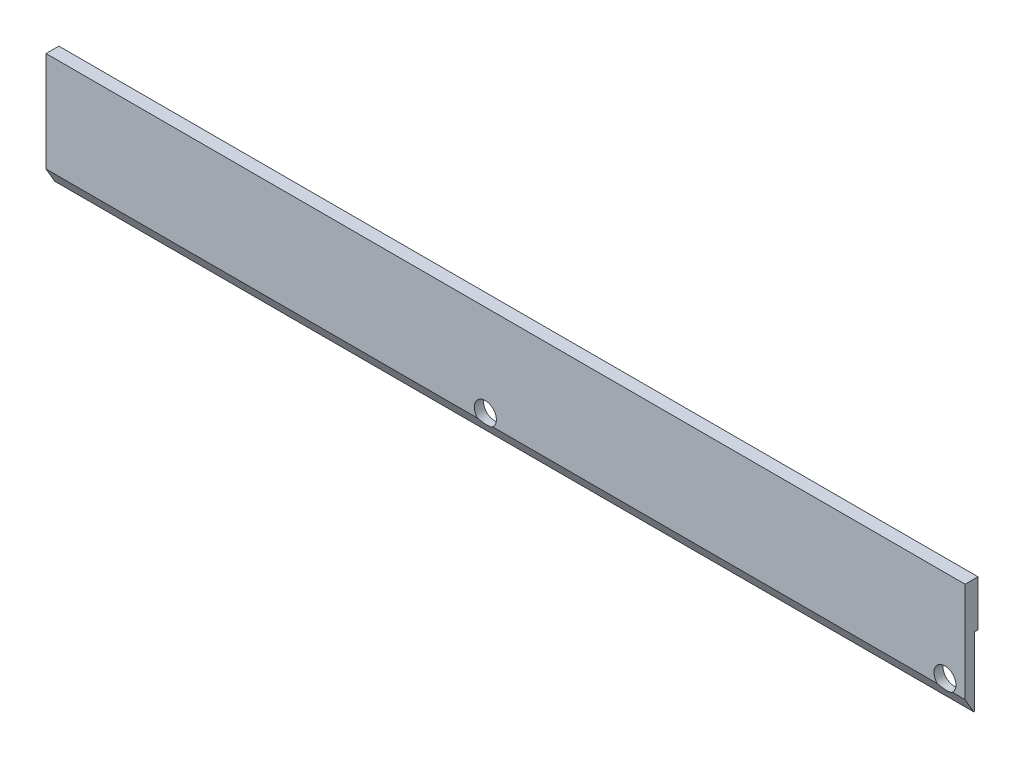
from build123d import *

# Parameters (mm, degrees)
SKETCH1_W           = 254
SKETCH1_H           = 31.75
SKETCH1_R           = 3.048
BOSS_EXTRUDE1_DEPTH = 2.54
CHAMFER1_SIZE       = 2.38
CHAMFER1_SIZE_2     = 4.122280922
SKETCH3_W           = 254
SKETCH3_H           = 12.7
BOSS_EXTRUDE2_DEPTH = 1.016
BOSS_EXTRUDE3_DEPTH = 1.016


with BuildPart() as part:
    # Sketch1 → Boss-Extrude1 (new body)
    with BuildSketch(Plane.XY):
        with Locations((127, 22.225)):
            Rectangle(SKETCH1_W, SKETCH1_H)
        with Locations((121.412, 12.7)):
            Circle(SKETCH1_R, mode=Mode.SUBTRACT)
        with Locations((248.412, 12.7)):
            Circle(SKETCH1_R, mode=Mode.SUBTRACT)
    extrude(amount=BOSS_EXTRUDE1_DEPTH)

    # Chamfer1
    # the kernel refuses this chamfer: 4.122280922, 2.38 mm, written as the material it takes off along each edge
    with BuildSketch(Plane(origin=(264.66469425, 6.35, 2.54), x_dir=(0, -0.05789386240267149, -0.9983227437537926), z_dir=(-1, 0, 0))) as chamfer1_piece_1:
        Polygon((CHAMFER1_SIZE * 0.998322743754, -CHAMFER1_SIZE * 0.0578938624027), (-CHAMFER1_SIZE_2 * 0.0578938624029, -CHAMFER1_SIZE_2 * 0.998322743757), (0, 0), align=None)
    extrude(amount=275.3293885, mode=Mode.SUBTRACT)

    # Sketch3 → Boss-Extrude2 (add)
    with BuildSketch(Plane(origin=(0, 0, 0), x_dir=(-1, 0, 0), z_dir=(0, 0, -1))):
        with Locations((-127, 31.75)):
            Rectangle(SKETCH3_W, SKETCH3_H)
    extrude(amount=BOSS_EXTRUDE2_DEPTH)

    # Sketch4 → Boss-Extrude3 (add)
    with BuildSketch(Plane(origin=(0, 0, 0), x_dir=(-1, 0, 0), z_dir=(0, 0, -1))):
        Polygon((0, 25.4), (0, 6.35), (-3.556, 6.35), (-14.224, 25.4), align=None)
    extrude(amount=BOSS_EXTRUDE3_DEPTH)


solid = part.part
